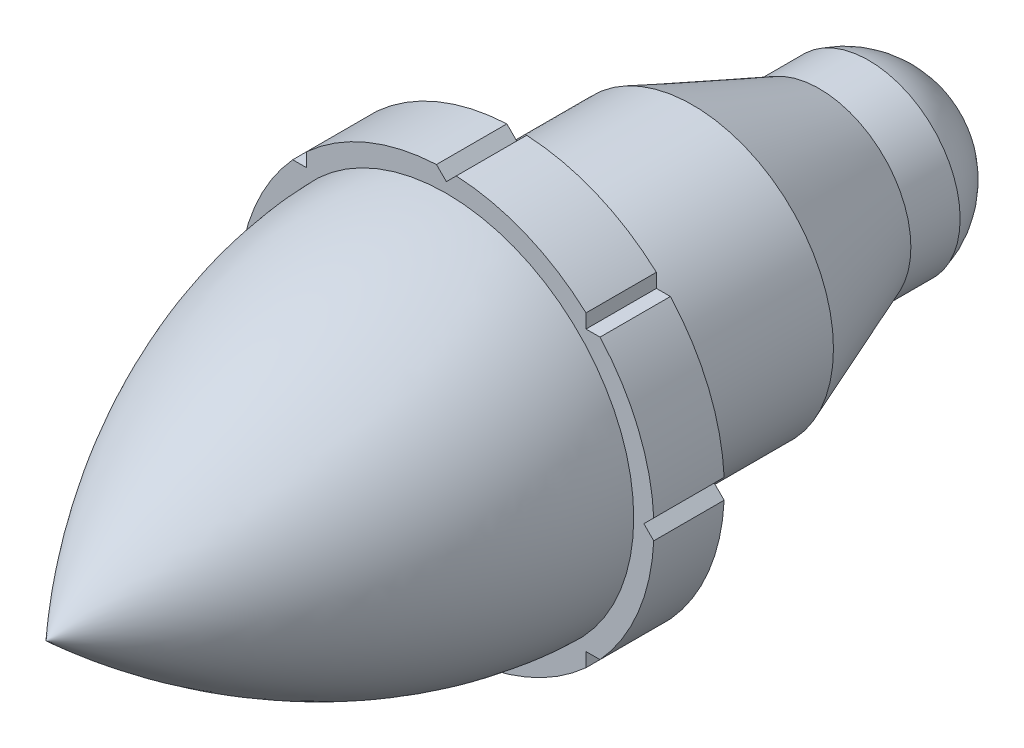
from build123d import *

# Parameters (mm, degrees)
DOME1_FACE_RADIUS  = 3.302
DOME1_HEIGHT       = 2.54
CUT_EXTRUDE4_DEPTH = 21.698272826
SEEDCUT_COUNT      = 8


# Read off the part's stored shape, not the designer's step: Cut-Revolve-Thin7
with BuildPart() as part:
    # Sketch1 → Revolve5 (revolve)
    with BuildSketch(Plane(origin=(0, 0, 0), x_dir=(0, 0, -1), z_dir=(1, 0, 0)), mode=Mode.PRIVATE) as revolve5_sk:
        Polygon((-7.325846616, 0), (-7.325846616, 7.493), (-4.785846616, 7.493), (-4.785846616, 5.08), (7.914153384, 5.08), (7.914153384, 0), align=None)
    revolve(revolve5_sk.sketch.rotate(Axis((0, 0, 20.020603184), (0, 0, -1)), 90), axis=Axis((0, 0, 20.020603184), (0, 0, -1)))

    # Sketch2 → Revolve12 (revolve)
    with BuildSketch(Plane(origin=(0, 0, 0), x_dir=(0, 0, -1), z_dir=(1, 0, 0))):
        with BuildLine():
            Line((-7.325846616, 0), (-21.775464383, 0))
            add(Edge.make_bspline(
                [(-7.325846616, 6.761687124), (-12.74249131, 6.612472482), (-17.889702324, 3.558506137), (-21.775464383, 0)],
                knots=[0, 0, 0, 0, 1, 1, 1, 1], degree=3))
            Line((-7.325846616, 6.761687124), (-7.325846616, 0))
        make_face()
    revolve(axis=Axis((0, 0, 22.807457961), (0, 0, -1)))

    # Cut-Revolve-Thin7 outline → Cut-Revolve-Thin7 (revolve, cut)
    with BuildSketch(Plane.XZ):
        Polygon((3.302, -6.136153384), (3.302, -7.914153384), (5.08, -7.914153384), (5.08, -1.564153384), align=None)
    revolve(axis=Axis((0, 0, 0), (0, 0, 1)), mode=Mode.SUBTRACT)

    # Dome1: a dome of height H over a round flat face of radius A is a cap of a sphere of radius (A * A + H * H) / (2 * H)
    dome1_r = (DOME1_FACE_RADIUS * DOME1_FACE_RADIUS + DOME1_HEIGHT * DOME1_HEIGHT) / (2 * DOME1_HEIGHT)
    dome1_base = Plane((0, 0, -7.914153384), z_dir=(0, 0, -1))
    with Locations(dome1_base.offset(DOME1_HEIGHT - dome1_r)):
        dome1_ball = Sphere(dome1_r, mode=Mode.PRIVATE)
    add(split(dome1_ball, bisect_by=dome1_base, keep=Keep.TOP, mode=Mode.PRIVATE))

    # Sketch6 → Cut-Extrude4 (cut, through all)
    with BuildSketch(Plane.XY.offset(7.325846616)):
        with BuildLine():
            Line((0, 7.127343562), (0.357140372, 7.484483934))
            ThreePointArc((0.357140372, 7.484483934), (0, 7.493), (-0.357140372, 7.484483934))
            Line((-0.357140372, 7.484483934), (0, 7.127343562))
        make_face()
    cut_extrude4 = extrude(amount=-CUT_EXTRUDE4_DEPTH, mode=Mode.SUBTRACT)

    # SeedCut: Cut-Extrude4 ×8 about axis
    seedcut_axis = Axis((0, 0, 0), (0, 0, 1))
    for i in range(1, SEEDCUT_COUNT):
        add(cut_extrude4.rotate(seedcut_axis, i * 360 / SEEDCUT_COUNT), mode=Mode.SUBTRACT)


solid = part.part
